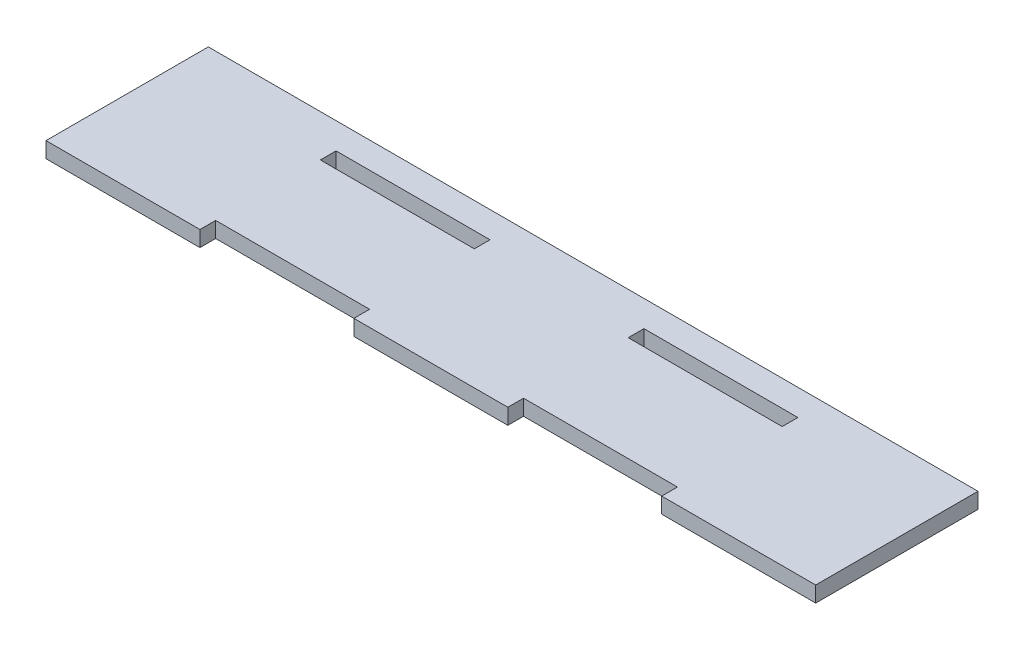
from build123d import *

# Parameters (mm, degrees)
SKETCH1_W           = 29.4
SKETCH1_H           = 3
BOSS_EXTRUDE1_DEPTH = 3


with BuildPart() as part:
    # Sketch1 → Boss-Extrude1 (new body)
    with BuildSketch(Plane(origin=(0, 0, 0), x_dir=(1, 0, 0), z_dir=(0, 1, 0))):
        Polygon((-73.5, 15.5), (73.5, 15.5), (73.5, -15.5), (44.1, -15.5), (44.1, -12.5), (14.7, -12.5), (14.7, -15.5), (-14.7, -15.5), (-14.7, -12.5), (-44.1, -12.5), (-44.1, -15.5), (-73.5, -15.5), align=None)
        with Locations((29.4, 9)):
            Rectangle(SKETCH1_W, SKETCH1_H, mode=Mode.SUBTRACT)
        with Locations((-29.4, 9)):
            Rectangle(SKETCH1_W, SKETCH1_H, mode=Mode.SUBTRACT)
    extrude(amount=BOSS_EXTRUDE1_DEPTH)


solid = part.part
